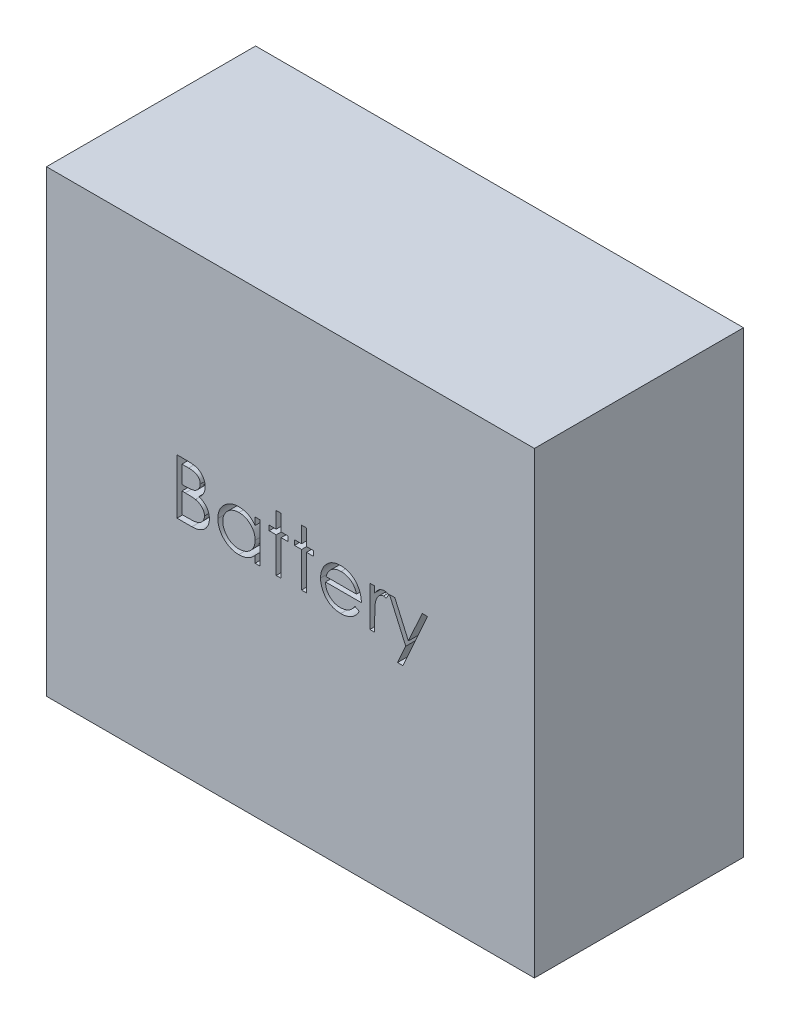
from build123d import *

# Parameters (mm, degrees)
SKETCH1_W           = 177.8
SKETCH1_H           = 76.2
BOSS_EXTRUDE1_DEPTH = 167.13
CUT_EXTRUDE1_DEPTH  = 20


with BuildPart() as part:
    # Sketch1 → Boss-Extrude1 (new body)
    with BuildSketch(Plane(origin=(0, 0, 0), x_dir=(1, 0, 0), z_dir=(0, 1, 0))):
        Rectangle(SKETCH1_W, SKETCH1_H)
    extrude(amount=BOSS_EXTRUDE1_DEPTH)

    # Sketch2 → Cut-Extrude1 (cut)
    # profile 1 of 7: a face of its own
    with BuildSketch(Plane.XY.offset(38.1)):
        with BuildLine():
            Line((-41.335897436, 100), (-37.433653846, 100))
            add(Edge.make_bspline(
                [(-37.433653846, 100), (-37.242633971, 99.998995712), (-36.872389912, 99.997049152), (-36.333993101, 99.966859831), (-35.829714183, 99.925696003), (-35.359406913, 99.860381188), (-34.923288613, 99.781571033), (-34.520044972, 99.686132084), (-34.150958273, 99.571694292), (-33.710314065, 99.389715542), (-33.207910289, 99.119297437), (-32.663919473, 98.719705636), (-32.198752391, 98.230948704), (-31.797687721, 97.679619244), (-31.478824181, 97.07312912), (-31.248142482, 96.425933755), (-31.10209748, 95.746380945), (-31.087077856, 95.279848499), (-31.079487179, 95.044070513)],
                knots=[0, 0, 0, 0, 1.001505555, 1.941167018, 2.826882275, 3.653841531, 4.429895133, 5.150066043, 5.825578002, 6.45369114, 7.647487171, 8.808567382, 9.977351308, 11.170798116, 12.373658725, 13.556498008, 14.765093433, 16, 16, 16, 16], degree=3))
            add(Edge.make_bspline(
                [(-31.079487179, 95.044070513), (-31.085734142, 94.823198766), (-31.098010013, 94.389164955), (-31.215397209, 93.754341473), (-31.399172457, 93.150048794), (-31.654631024, 92.578492306), (-31.98664243, 92.052585945), (-32.380118537, 91.568087282), (-32.854843123, 91.145509813), (-33.21051878, 90.909264656), (-33.391185897, 90.789262821)],
                knots=[0, 0, 0, 0, 1.044552857, 2.05264487, 3.044412934, 4.028983338, 5.005914585, 5.980388656, 6.974128949, 8, 8, 8, 8], degree=3))
            add(Edge.make_bspline(
                [(-33.391185897, 90.789262821), (-33.163983454, 90.702034255), (-32.729288898, 90.535144401), (-32.131083112, 90.240084607), (-31.615683998, 89.919158262), (-31.179128878, 89.568690547), (-30.80577085, 89.190925914), (-30.479754041, 88.780325261), (-30.20157476, 88.331532359), (-29.963215197, 87.849226443), (-29.777222305, 87.338332338), (-29.637931423, 86.803642189), (-29.558117428, 86.247073302), (-29.546759478, 85.868299705), (-29.541025641, 85.677083333)],
                knots=[0, 0, 0, 0, 1.27268992, 2.434971085, 3.483601985, 4.442670788, 5.356604649, 6.2567628, 7.179492994, 8.113709626, 9.066344395, 10.018646069, 10.999752585, 12, 12, 12, 12], degree=3))
            add(Edge.make_bspline(
                [(-29.541025641, 85.677083333), (-29.546607618, 85.481844064), (-29.557590315, 85.097705332), (-29.638618725, 84.533390277), (-29.775813622, 83.994104868), (-29.964791602, 83.476360967), (-30.211433399, 82.981160199), (-30.511593195, 82.507941547), (-30.869487845, 82.061459658), (-31.269847096, 81.63675324), (-31.722773642, 81.25488017), (-32.211435098, 80.914790417), (-32.741985498, 80.635098634), (-33.305711178, 80.40014994), (-33.908935841, 80.220680234), (-34.54895074, 80.095122669), (-35.225203894, 80.010522457), (-35.689259614, 80.003567001), (-35.92724359, 80)],
                knots=[0, 0, 0, 0, 0.978564426, 1.925352924, 2.850884081, 3.763762016, 4.682927383, 5.618979971, 6.567305752, 7.547517671, 8.540179244, 9.531824382, 10.526200242, 11.540722885, 12.589160233, 13.674978461, 14.80764778, 16, 16, 16, 16], degree=3))
            Line((-35.92724359, 80), (-41.335897436, 80))
            Line((-41.335897436, 80), (-41.335897436, 100))
        make_face()
        with BuildLine():
            Line((-39.541025641, 97.948717949), (-39.541025641, 91.538461538))
            Line((-39.541025641, 91.538461538), (-38.335096154, 91.538461538))
            add(Edge.make_bspline(
                [(-38.335096154, 91.538461538), (-38.158817323, 91.540746813), (-37.818210699, 91.545162428), (-37.324954147, 91.557811097), (-36.8670969, 91.593228488), (-36.445429283, 91.6286357), (-36.060615317, 91.686204772), (-35.713507537, 91.754731189), (-35.398658412, 91.827204933), (-35.035575294, 91.950459143), (-34.623729875, 92.132617287), (-34.184683565, 92.415313494), (-33.797629453, 92.752024083), (-33.470788381, 93.140543865), (-33.203294263, 93.568350641), (-33.017501605, 94.028618529), (-32.891517124, 94.509876427), (-32.880136945, 94.840266443), (-32.874358974, 95.008012821)],
                knots=[0, 0, 0, 0, 1.156816544, 2.235205308, 3.236616184, 4.169592532, 5.011045266, 5.787822928, 6.49130361, 7.128639758, 8.301311294, 9.436451833, 10.541879658, 11.654887649, 12.756523258, 13.837046038, 14.901820046, 16, 16, 16, 16], degree=3))
            add(Edge.make_bspline(
                [(-32.874358974, 95.008012821), (-32.877365718, 95.119017229), (-32.883263775, 95.336764498), (-32.931568361, 95.654189379), (-33.013668786, 95.952725108), (-33.119121891, 96.236462881), (-33.266485826, 96.496530597), (-33.439991331, 96.741920286), (-33.649623847, 96.964275249), (-33.888237062, 97.172100954), (-34.16257205, 97.356355398), (-34.472465146, 97.517731188), (-34.822109015, 97.647678483), (-35.205611043, 97.761485069), (-35.6288744, 97.841418176), (-36.087014706, 97.908008963), (-36.583784529, 97.941910346), (-36.927470829, 97.946398134), (-37.105128205, 97.948717949)],
                knots=[0, 0, 0, 0, 0.91205012, 1.789085906, 2.630437955, 3.453916878, 4.269457761, 5.079663411, 5.91843418, 6.774407191, 7.675494373, 8.627863946, 9.638891023, 10.736472738, 11.911756761, 13.175263542, 14.539845004, 16, 16, 16, 16], degree=3))
            Line((-37.105128205, 97.948717949), (-39.541025641, 97.948717949))
        make_face(mode=Mode.SUBTRACT)
        with BuildLine():
            Line((-39.541025641, 89.487179487), (-39.541025641, 82.051282051))
            Line((-39.541025641, 82.051282051), (-36.984935897, 82.051282051))
            add(Edge.make_bspline(
                [(-36.984935897, 82.051282051), (-36.801970607, 82.053474894), (-36.449329129, 82.057701308), (-35.940179243, 82.071498763), (-35.468275792, 82.102883195), (-35.035772159, 82.15228805), (-34.637998144, 82.205879188), (-34.279725556, 82.277943651), (-33.958050165, 82.36050914), (-33.58505412, 82.488132981), (-33.165034073, 82.686398529), (-32.712400608, 82.985336966), (-32.309965076, 83.341470153), (-31.968220737, 83.753646805), (-31.688146517, 84.201825816), (-31.484401059, 84.676942102), (-31.358739021, 85.171145116), (-31.343526625, 85.508097759), (-31.335897436, 85.677083333)],
                knots=[0, 0, 0, 0, 1.160039823, 2.235823828, 3.228722157, 4.157150951, 4.99529583, 5.772374946, 6.472645482, 7.099169577, 8.269452708, 9.405989375, 10.527446681, 11.663510218, 12.788923519, 13.866172445, 14.929861265, 16, 16, 16, 16], degree=3))
            add(Edge.make_bspline(
                [(-31.335897436, 85.677083333), (-31.337475175, 85.782759565), (-31.340605204, 85.992407461), (-31.387808718, 86.300497856), (-31.456459402, 86.598931418), (-31.545210453, 86.888518506), (-31.674464551, 87.164023514), (-31.825359094, 87.430895283), (-32.002281389, 87.689486594), (-32.277962337, 88.016413756), (-32.678945105, 88.393082402), (-33.248698108, 88.761868129), (-33.896539811, 89.059284169), (-34.366411199, 89.185566891), (-34.609134615, 89.250801282)],
                knots=[0, 0, 0, 0, 0.723448775, 1.435228256, 2.130040452, 2.821711965, 3.505591119, 4.210454504, 4.921174351, 5.648778258, 7.137944449, 8.670945889, 10.280296675, 12, 12, 12, 12], degree=3))
            add(Edge.make_bspline(
                [(-34.609134615, 89.250801282), (-34.706443735, 89.270544619), (-34.917429977, 89.313352246), (-35.261473293, 89.358539122), (-35.654249687, 89.398796607), (-36.096666128, 89.428574651), (-36.589282363, 89.4593549), (-37.13315047, 89.471325306), (-37.726049411, 89.485606793), (-38.137434396, 89.486641845), (-38.351121795, 89.487179487)],
                knots=[0, 0, 0, 0, 0.634451884, 1.375622551, 2.216452059, 3.157844607, 4.20941857, 5.370758133, 6.634282058, 8, 8, 8, 8], degree=3))
            Line((-38.351121795, 89.487179487), (-39.541025641, 89.487179487))
        make_face(mode=Mode.SUBTRACT)
    # profile 2 of 7: a face of its own
    with BuildSketch(Plane.XY.offset(38.1)):
        with BuildLine():
            Line((-11.079487179, 94.615384615), (-11.079487179, 80))
            Line((-11.079487179, 80), (-12.874358974, 80))
            Line((-12.874358974, 80), (-12.874358974, 82.528044872))
            add(Edge.make_bspline(
                [(-12.874358974, 82.528044872), (-13.076752064, 82.299247192), (-13.471724722, 81.852745643), (-14.131388254, 81.269418943), (-14.830634985, 80.787257106), (-15.566071105, 80.397829016), (-16.337032496, 80.10530298), (-17.141810137, 79.89738207), (-17.980732314, 79.763703012), (-18.553602913, 79.750354316), (-18.843910256, 79.743589744)],
                knots=[0, 0, 0, 0, 1.074387032, 2.096679803, 3.090159297, 4.057316773, 5.018401886, 5.985159533, 6.978961417, 8, 8, 8, 8], degree=3))
            add(Edge.make_bspline(
                [(-18.843910256, 79.743589744), (-19.10201285, 79.750597585), (-19.611002592, 79.764417359), (-20.359740176, 79.871630522), (-21.080267315, 80.043805503), (-21.773264873, 80.283239158), (-22.434248562, 80.600843853), (-23.068877685, 80.981079556), (-23.673864497, 81.433884299), (-24.239987577, 81.951530175), (-24.761313293, 82.513787245), (-25.21880628, 83.113476084), (-25.60025245, 83.748003535), (-25.91922434, 84.409335843), (-26.164917737, 85.102563955), (-26.336195647, 85.825290629), (-26.443283914, 86.576661334), (-26.457097975, 87.088315752), (-26.464102564, 87.34775641)],
                knots=[0, 0, 0, 0, 1.033919861, 2.038935746, 3.024066025, 3.998881131, 4.97069526, 5.957263378, 6.95902576, 7.993208707, 9.027059324, 10.027763471, 11.009749337, 11.988697705, 12.965288445, 13.950418724, 14.960734635, 16, 16, 16, 16], degree=3))
            add(Edge.make_bspline(
                [(-26.464102564, 87.34775641), (-26.456942728, 87.601834716), (-26.442788117, 88.104133821), (-26.337341147, 88.842869238), (-26.160021097, 89.554402157), (-25.911176253, 90.236441832), (-25.592079368, 90.889813547), (-25.203918871, 91.514979405), (-24.746666729, 92.113661676), (-24.219510118, 92.671782972), (-23.648454288, 93.187329339), (-23.037547255, 93.635381027), (-22.401985647, 94.022334449), (-21.731911301, 94.328925742), (-21.037242131, 94.576977768), (-20.311793869, 94.748594729), (-19.558584848, 94.849722279), (-19.047210608, 94.864366645), (-18.787820513, 94.871794872)],
                knots=[0, 0, 0, 0, 1.020392517, 2.01726096, 2.990465484, 3.961182959, 4.928053699, 5.906110375, 6.912531644, 7.948652711, 8.985773172, 9.998621852, 10.987621588, 11.969261332, 12.953316658, 13.946091881, 14.958173133, 16, 16, 16, 16], degree=3))
            add(Edge.make_bspline(
                [(-18.787820513, 94.871794872), (-18.489535604, 94.863579149), (-17.904612975, 94.847468503), (-17.049024351, 94.713395776), (-16.239627334, 94.486890249), (-15.470173894, 94.178790261), (-14.743427117, 93.769368952), (-14.066267206, 93.252912031), (-13.431607302, 92.632676677), (-13.063719921, 92.156274138), (-12.874358974, 91.911057692)],
                knots=[0, 0, 0, 0, 1.038897134, 2.037228247, 3.008116434, 3.962042015, 4.918381754, 5.904844433, 6.921570401, 8, 8, 8, 8], degree=3))
            Line((-12.874358974, 91.911057692), (-12.874358974, 94.615384615))
            Line((-12.874358974, 94.615384615), (-11.079487179, 94.615384615))
        make_face()
        with BuildLine():
            add(Edge.make_bspline(
                [(-18.763782051, 93.076923077), (-19.026149696, 93.067588004), (-19.544021696, 93.049162055), (-20.304273136, 92.905313511), (-21.03177836, 92.665972972), (-21.722898784, 92.338647823), (-22.366717165, 91.927055042), (-22.94210957, 91.429218566), (-23.453782149, 90.858721342), (-23.884115087, 90.218137854), (-24.234917927, 89.531405905), (-24.481586681, 88.813551973), (-24.644268095, 88.07752353), (-24.660888212, 87.578308183), (-24.669230769, 87.327724359)],
                knots=[0, 0, 0, 0, 1.031046209, 2.035121221, 3.029706178, 4.034933723, 5.034054252, 6.02443088, 7.017295772, 8.038157696, 9.050218397, 10.03989886, 11.016116709, 12, 12, 12, 12], degree=3))
            add(Edge.make_bspline(
                [(-24.669230769, 87.327724359), (-24.658574236, 87.078638032), (-24.63730294, 86.581441713), (-24.484441829, 85.844409846), (-24.227985409, 85.126386748), (-23.878030765, 84.433466785), (-23.439821481, 83.790129069), (-22.931886323, 83.20875694), (-22.349313287, 82.708816436), (-21.704013247, 82.290316015), (-21.014824845, 81.952244467), (-20.290059522, 81.717012241), (-19.54334159, 81.565139209), (-19.035613968, 81.547399341), (-18.779807692, 81.538461538)],
                knots=[0, 0, 0, 0, 0.979072187, 1.954306742, 2.945804271, 3.96968567, 4.997920485, 5.998718438, 6.996577872, 8.005894225, 9.015743152, 10.005417472, 10.995077863, 12, 12, 12, 12], degree=3))
            add(Edge.make_bspline(
                [(-18.779807692, 81.538461538), (-18.520113391, 81.547947047), (-18.003607182, 81.566812782), (-17.24110028, 81.711277155), (-16.501129064, 81.949956002), (-15.793773473, 82.280808155), (-15.134824152, 82.690850189), (-14.543407709, 83.170890709), (-14.043316461, 83.729194618), (-13.619358692, 84.34277435), (-13.286927739, 85.01541433), (-13.04477883, 85.731609705), (-12.901613654, 86.491385409), (-12.883569484, 87.010607849), (-12.874358974, 87.275641026)],
                knots=[0, 0, 0, 0, 1.01762866, 2.023962475, 3.030623092, 4.058876274, 5.077231937, 6.066672613, 7.034107872, 8.005628644, 8.981990164, 9.965428785, 10.961468474, 12, 12, 12, 12], degree=3))
            add(Edge.make_bspline(
                [(-12.874358974, 87.275641026), (-12.879842725, 87.477571486), (-12.890636482, 87.875034533), (-12.973096879, 88.458620348), (-13.104267887, 89.017098783), (-13.289103144, 89.551057006), (-13.531910484, 90.057542808), (-13.82475486, 90.540192866), (-14.172786002, 90.996496931), (-14.570401408, 91.420171623), (-15.005631137, 91.80660855), (-15.466171369, 92.151547068), (-15.957478495, 92.434911484), (-16.471290134, 92.669433035), (-17.00849776, 92.856056749), (-17.57347273, 92.980557856), (-18.160209798, 93.066045405), (-18.560472972, 93.073259009), (-18.763782051, 93.076923077)],
                knots=[0, 0, 0, 0, 1.050140795, 2.067009409, 3.05949893, 4.030605086, 5.00011959, 5.97591094, 6.962425594, 7.979863591, 8.993523472, 9.986985069, 10.967611495, 11.937549037, 12.921786183, 13.919465291, 14.943216303, 16, 16, 16, 16], degree=3))
        make_face(mode=Mode.SUBTRACT)
    # profile 3 of 7: a face of its own
    with BuildSketch(Plane.XY.offset(38.1)):
        Polygon((-5.182051282, 100.512820513), (-3.387179487, 100.512820513), (-3.387179487, 94.615384615), (-0.823076923, 94.615384615), (-0.823076923, 92.820512821), (-3.387179487, 92.820512821), (-3.387179487, 80), (-5.182051282, 80), (-5.182051282, 92.820512821), (-7.746153846, 92.820512821), (-7.746153846, 94.615384615), (-5.182051282, 94.615384615), align=None)
    # profile 4 of 7: a face of its own
    with BuildSketch(Plane.XY.offset(38.1)):
        Polygon((4.048717949, 100.512820513), (5.843589744, 100.512820513), (5.843589744, 94.615384615), (8.407692308, 94.615384615), (8.407692308, 92.820512821), (5.843589744, 92.820512821), (5.843589744, 80), (4.048717949, 80), (4.048717949, 92.820512821), (1.484615385, 92.820512821), (1.484615385, 94.615384615), (4.048717949, 94.615384615), align=None)
    # profile 5 of 7: a face of its own
    with BuildSketch(Plane.XY.offset(38.1)):
        with BuildLine():
            Line((23.479807692, 84.615384615), (25.074358974, 83.778044872))
            add(Edge.make_bspline(
                [(25.074358974, 83.778044872), (24.947292716, 83.552654407), (24.700072096, 83.11413382), (24.274924965, 82.511666046), (23.829255979, 81.969679098), (23.34294759, 81.502652502), (22.830549425, 81.095501731), (22.289219969, 80.73928559), (21.716141011, 80.435751188), (21.11128544, 80.180022457), (20.46957372, 79.983396776), (19.789450769, 79.844515514), (19.069613652, 79.758668264), (18.57620691, 79.748696031), (18.323557692, 79.743589744)],
                knots=[0, 0, 0, 0, 1.120438281, 2.179929193, 3.190490725, 4.156257408, 5.095198341, 6.022838206, 6.959905092, 7.901321166, 8.864066838, 9.862729781, 10.905609505, 12, 12, 12, 12], degree=3))
            add(Edge.make_bspline(
                [(18.323557692, 79.743589744), (18.042746392, 79.750145031), (17.494964897, 79.762932498), (16.697594913, 79.873175152), (15.94685538, 80.053017202), (15.242788503, 80.304248867), (14.587118489, 80.632405005), (13.978542175, 81.032173473), (13.413859171, 81.501500642), (12.910863689, 82.044451748), (12.458041503, 82.625491504), (12.058465388, 83.230953701), (11.724422925, 83.859314984), (11.452693724, 84.506575121), (11.233237353, 85.168654513), (11.08028476, 85.851577184), (10.992114771, 86.553494809), (10.978603654, 87.028336727), (10.971794872, 87.267628205)],
                knots=[0, 0, 0, 0, 1.145258523, 2.234067595, 3.276747158, 4.290159414, 5.277019952, 6.260822364, 7.254936242, 8.264827045, 9.274100331, 10.257902744, 11.220704747, 12.172965371, 13.118907548, 14.062713208, 15.023725156, 16, 16, 16, 16], degree=3))
            add(Edge.make_bspline(
                [(10.971794872, 87.267628205), (10.977847108, 87.492170093), (10.989841841, 87.937182463), (11.06544634, 88.595842717), (11.199436586, 89.236005303), (11.383301295, 89.858202149), (11.620736987, 90.461391486), (11.911206811, 91.045940421), (12.255163256, 91.611226934), (12.520721391, 91.96781627), (12.654487179, 92.147435897)],
                knots=[0, 0, 0, 0, 1.024358464, 2.0301432, 3.019427413, 4.004406732, 4.986367066, 5.972626655, 6.978780325, 8, 8, 8, 8], degree=3))
            add(Edge.make_bspline(
                [(12.654487179, 92.147435897), (12.835673938, 92.363829441), (13.192307919, 92.789761729), (13.795487092, 93.349409305), (14.448631071, 93.818230877), (15.143554649, 94.206843084), (15.888334501, 94.502121067), (16.672959021, 94.722164394), (17.506362371, 94.845467314), (18.07610649, 94.862883506), (18.367628205, 94.871794872)],
                knots=[0, 0, 0, 0, 1.030682036, 2.02871468, 2.997146059, 3.962720338, 4.930598197, 5.918074684, 6.934738563, 8, 8, 8, 8], degree=3))
            add(Edge.make_bspline(
                [(18.367628205, 94.871794872), (18.667328807, 94.86405745), (19.255273069, 94.848878391), (20.112599475, 94.708156486), (20.92380357, 94.484999031), (21.688560737, 94.169834514), (22.406948513, 93.763208504), (23.074297368, 93.259540838), (23.702020297, 92.674294625), (24.067212176, 92.224219143), (24.253044872, 91.995192308)],
                knots=[0, 0, 0, 0, 1.056321875, 2.072262726, 3.055038591, 4.01806755, 4.982017516, 5.957941055, 6.960871419, 8, 8, 8, 8], degree=3))
            add(Edge.make_bspline(
                [(24.253044872, 91.995192308), (24.379484519, 91.822600414), (24.631522194, 91.47856545), (24.947219909, 90.91758741), (25.221262166, 90.330669728), (25.440307657, 89.708325173), (25.617676235, 89.057927572), (25.746000914, 88.374827316), (25.821255877, 87.659227823), (25.836048434, 87.171647506), (25.843589744, 86.923076923)],
                knots=[0, 0, 0, 0, 0.94817472, 1.890038105, 2.849395472, 3.817997239, 4.812318967, 5.836947057, 6.897266129, 8, 8, 8, 8], degree=3))
            Line((25.843589744, 86.923076923), (12.766666667, 86.923076923))
            add(Edge.make_bspline(
                [(12.766666667, 86.923076923), (12.775464418, 86.730502842), (12.79276484, 86.351813677), (12.873422801, 85.797694917), (13.000558651, 85.269847247), (13.179239009, 84.772229865), (13.395620982, 84.298343422), (13.660682221, 83.851703211), (13.976908244, 83.43434361), (14.329626526, 83.042531395), (14.722238499, 82.69361276), (15.135282769, 82.381316896), (15.574674569, 82.119570629), (16.036949332, 81.907114116), (16.521359532, 81.74079231), (17.02805779, 81.627261906), (17.556047027, 81.551221295), (17.915965507, 81.542766066), (18.099198718, 81.538461538)],
                knots=[0, 0, 0, 0, 1.094153842, 2.151609401, 3.174256925, 4.172055639, 5.149267565, 6.128595816, 7.11444997, 8.118368179, 9.117203808, 10.09244225, 11.054858984, 12.015122123, 12.976791628, 13.957293641, 14.960065497, 16, 16, 16, 16], degree=3))
            add(Edge.make_bspline(
                [(18.099198718, 81.538461538), (18.278348133, 81.541936148), (18.633814938, 81.54883044), (19.163191266, 81.615869931), (19.683988565, 81.724271506), (20.194051327, 81.872214306), (20.683027589, 82.052653461), (21.135859304, 82.270384076), (21.552317679, 82.511239772), (21.941557488, 82.786723629), (22.319106021, 83.123913269), (22.693634515, 83.544688818), (23.095215391, 84.042331834), (23.346584493, 84.416878496), (23.479807692, 84.615384615)],
                knots=[0, 0, 0, 0, 0.99110716, 1.966546729, 2.947904876, 3.932708344, 4.903319531, 5.828989031, 6.710028674, 7.56322171, 8.463672341, 9.504779593, 10.677557249, 12, 12, 12, 12], degree=3))
        make_face()
        with BuildLine():
            add(Edge.make_bspline(
                [(24.048717949, 88.717948718), (23.983022951, 88.956022282), (23.856581229, 89.414237257), (23.592373432, 90.048756631), (23.294821771, 90.612687494), (22.942697591, 91.101713968), (22.543733445, 91.536019757), (22.08290383, 91.915554529), (21.566127295, 92.255082821), (20.996075063, 92.541668532), (20.39240772, 92.785610582), (19.760372337, 92.949182672), (19.115470692, 93.061237199), (18.67927477, 93.071672105), (18.459775641, 93.076923077)],
                knots=[0, 0, 0, 0, 1.154881502, 2.222775134, 3.210006277, 4.132804581, 5.035138423, 5.962687519, 6.919655026, 7.923214229, 8.944639381, 9.960483929, 10.97369054, 12, 12, 12, 12], degree=3))
            add(Edge.make_bspline(
                [(18.459775641, 93.076923077), (18.280635992, 93.073427811), (17.926514569, 93.066518405), (17.40479418, 93.000974809), (16.903767329, 92.892632838), (16.419737114, 92.744261658), (15.959046437, 92.546498215), (15.51221919, 92.314594063), (15.090616926, 92.031499298), (14.82695238, 91.815734413), (14.69375, 91.706730769)],
                knots=[0, 0, 0, 0, 1.04873581, 2.073130211, 3.073294108, 4.04793562, 5.032784715, 6.005352987, 6.992311501, 8, 8, 8, 8], degree=3))
            add(Edge.make_bspline(
                [(14.69375, 91.706730769), (14.598359817, 91.620477537), (14.405313336, 91.445922017), (14.147367499, 91.145183694), (13.900393369, 90.820889053), (13.675629639, 90.460631198), (13.469472002, 90.068512461), (13.276557847, 89.647840259), (13.102921207, 89.195422372), (13.005229149, 88.880151291), (12.954967949, 88.717948718)],
                knots=[0, 0, 0, 0, 0.879870761, 1.780643979, 2.707998968, 3.669668524, 4.684282772, 5.740141944, 6.837334558, 8, 8, 8, 8], degree=3))
            Line((12.954967949, 88.717948718), (24.048717949, 88.717948718))
        make_face(mode=Mode.SUBTRACT)
    # profile 6 of 7: a face of its own
    with BuildSketch(Plane.XY.offset(38.1)):
        with BuildLine():
            Line((28.920512821, 94.615384615), (30.715384615, 94.615384615))
            Line((30.715384615, 94.615384615), (30.715384615, 92.463942308))
            add(Edge.make_bspline(
                [(30.715384615, 92.463942308), (30.847891808, 92.664261327), (31.101310785, 93.047369894), (31.522527524, 93.554051614), (31.953975132, 93.973566166), (32.397719059, 94.307871988), (32.857022487, 94.558232667), (33.321805068, 94.741621438), (33.799379182, 94.85006324), (34.120304463, 94.864541291), (34.281089744, 94.871794872)],
                knots=[0, 0, 0, 0, 1.2804753, 2.448899062, 3.506932113, 4.484331642, 5.4025378, 6.288909075, 7.142734305, 8, 8, 8, 8], degree=3))
            add(Edge.make_bspline(
                [(34.281089744, 94.871794872), (34.405811609, 94.864991863), (34.662434953, 94.850994229), (35.050906895, 94.75264666), (35.451155192, 94.595629388), (35.70911169, 94.447970973), (35.843589744, 94.37099359)],
                knots=[0, 0, 0, 0, 0.901110191, 1.854092781, 2.881294221, 4, 4, 4, 4], degree=3))
            Line((35.843589744, 94.37099359), (34.858012821, 92.81650641))
            add(Edge.make_bspline(
                [(34.858012821, 92.81650641), (34.771675557, 92.855022217), (34.607790902, 92.92813259), (34.368050524, 93.014658363), (34.147014314, 93.065606453), (34.00619398, 93.073324839), (33.940544872, 93.076923077)],
                knots=[0, 0, 0, 0, 1.180555205, 2.24091978, 3.179933427, 4, 4, 4, 4], degree=3))
            add(Edge.make_bspline(
                [(33.940544872, 93.076923077), (33.796512109, 93.067322863), (33.502727023, 93.047741211), (33.071387027, 92.893805166), (32.652831567, 92.645089508), (32.320422068, 92.369254584), (32.063037766, 92.103267169), (31.879379334, 91.870990583), (31.710906494, 91.61054126), (31.549933806, 91.326371639), (31.403269268, 91.013629661), (31.266385444, 90.67543987), (31.142620513, 90.311410563), (31.072047689, 90.057796162), (31.035897436, 89.927884615)],
                knots=[0, 0, 0, 0, 1.125678352, 2.296057538, 3.5422874, 4.923748041, 5.663163013, 6.437101912, 7.23742474, 8.08941207, 8.991984279, 9.93940061, 10.944477711, 12, 12, 12, 12], degree=3))
            add(Edge.make_bspline(
                [(31.035897436, 89.927884615), (31.008855188, 89.812015052), (30.948958664, 89.555372774), (30.890721305, 89.124809776), (30.833181202, 88.616103154), (30.792629097, 88.027836909), (30.755040285, 87.361480087), (30.733839815, 86.61601754), (30.716107584, 85.790684105), (30.715632916, 85.213687801), (30.715384615, 84.911858974)],
                knots=[0, 0, 0, 0, 0.566838948, 1.255505196, 2.06880316, 3.007127437, 4.065329342, 5.249902469, 6.561414163, 8, 8, 8, 8], degree=3))
            Line((30.715384615, 84.911858974), (30.715384615, 80))
            Line((30.715384615, 80), (28.920512821, 80))
            Line((28.920512821, 80), (28.920512821, 94.615384615))
        make_face()
    # profile 7 of 7: a face of its own
    with BuildSketch(Plane.XY.offset(38.1)):
        Polygon((36.1, 94.615384615), (38.035096154, 94.615384615), (42.983012821, 83.421474359), (48.007051282, 94.615384615), (49.946153846, 94.615384615), (40.971794872, 74.615384615), (39.032692308, 74.615384615), (42.009455128, 81.24599359), align=None)
    extrude(amount=-CUT_EXTRUDE1_DEPTH, mode=Mode.SUBTRACT)


solid = part.part
